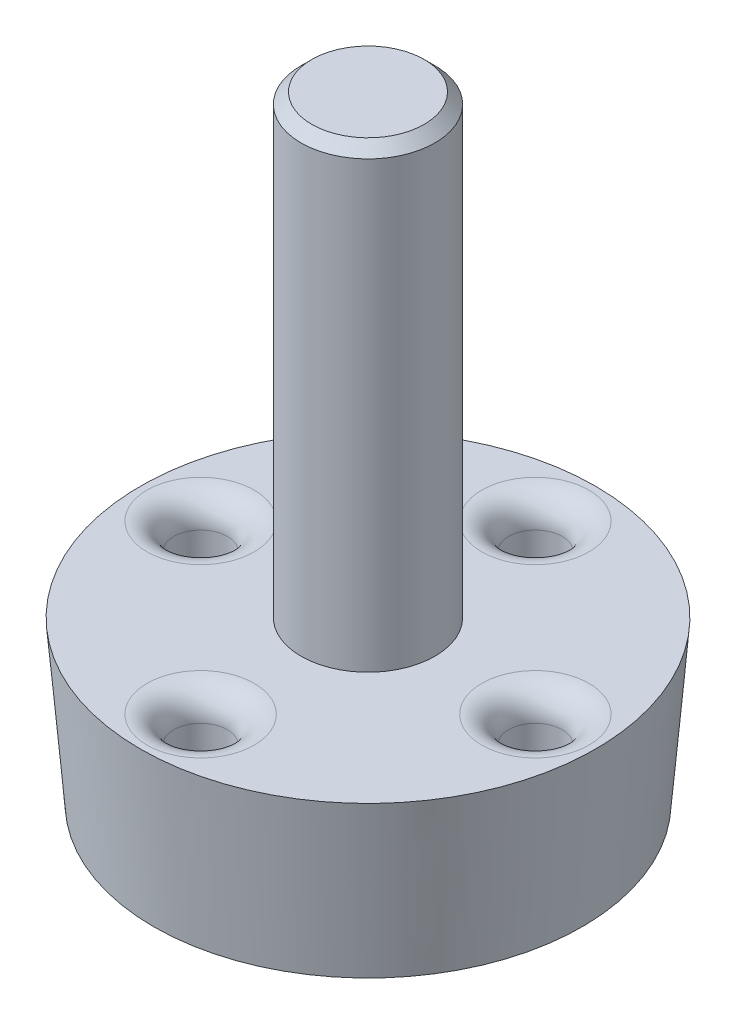
from build123d import *

# Parameters (mm, degrees)
SKETCH3_R           = 8.5
SKETCH1_R           = 8
SKETCH4_R           = 2.5
BOSS_EXTRUDE1_DEPTH = 17
SKETCH5_R           = 4.5
CUT_EXTRUDE1_DEPTH  = 2
SKETCH6_R           = 1
CUT_EXTRUDE4_DEPTH  = 6
SKETCH8_R           = 2
CUT_EXTRUDE5_DEPTH  = 1
FILLET1_R           = 1
CHAMFER1_SIZE       = 0.4
FILLET2_R           = 1


with BuildPart() as part:
    # Sketch3 → Loft1 section 0
    with BuildSketch(Plane(origin=(0, 6, 0), x_dir=(1, 0, 0), z_dir=(0, 1, 0))):
        Circle(SKETCH3_R)
    # Sketch1 → Loft1 section 1
    with BuildSketch(Plane(origin=(0, 0, 0), x_dir=(1, 0, 0), z_dir=(0, 1, 0))):
        Circle(SKETCH1_R)
    loft()

    # Sketch4 → Boss-Extrude1 (add)
    with BuildSketch(Plane(origin=(0, 6, 0), x_dir=(1, 0, 0), z_dir=(0, 1, 0))):
        with Locations(Location((0, 0, 0), (0, 0, 270))):
            Circle(SKETCH4_R)
    extrude(amount=BOSS_EXTRUDE1_DEPTH)

    # Sketch5 → Cut-Extrude1 (cut)
    with BuildSketch(Plane.XZ):
        with Locations(Location((0, 0, 0), (0, 0, 270))):
            Circle(SKETCH5_R)
    extrude(amount=-CUT_EXTRUDE1_DEPTH, mode=Mode.SUBTRACT)

    # Sketch6 → Cut-Extrude4 (cut)
    with BuildSketch(Plane.XZ):
        with Locations(Location((0, 6.25, 0), (0, 0, 270))):
            Circle(SKETCH6_R)
        with Locations(Location((6.25, 0, 0), (0, 0, 270))):
            Circle(SKETCH6_R)
        with Locations(Location((0, -6.25, 0), (0, 0, 270))):
            Circle(SKETCH6_R)
        with Locations(Location((-6.25, 0, 0), (0, 0, 270))):
            Circle(SKETCH6_R)
    extrude(amount=-CUT_EXTRUDE4_DEPTH, mode=Mode.SUBTRACT)

    # Sketch8 → Cut-Extrude5 (cut)
    with BuildSketch(Plane.XZ.offset(-2)):
        with Locations(Location((0, 0, 0), (0, 0, 270))):
            Circle(SKETCH8_R)
    extrude(amount=-CUT_EXTRUDE5_DEPTH, mode=Mode.SUBTRACT)

    # Fillet1
    fillet1_edges = [part.edges().sort_by_distance(p)[0] for p in [
        (0, 2, 2),
    ]]
    fillet(fillet1_edges, radius=FILLET1_R - 0.0001)  # a hair under: the kernel refuses the full size

    # Chamfer1
    chamfer1_edges = [part.edges().sort_by_distance(p)[0] for p in [
        (0, 23, -2.5),
    ]]
    chamfer(chamfer1_edges, length=CHAMFER1_SIZE)

    # Fillet2
    fillet2_edges = [part.edges().sort_by_distance(p)[0] for p in [
        (0, 6, 7.25),
        (6.25, 6, 1),
        (0, 6, -5.25),
        (-6.25, 6, 1),
    ]]
    fillet(fillet2_edges, radius=FILLET2_R)


solid = part.part
